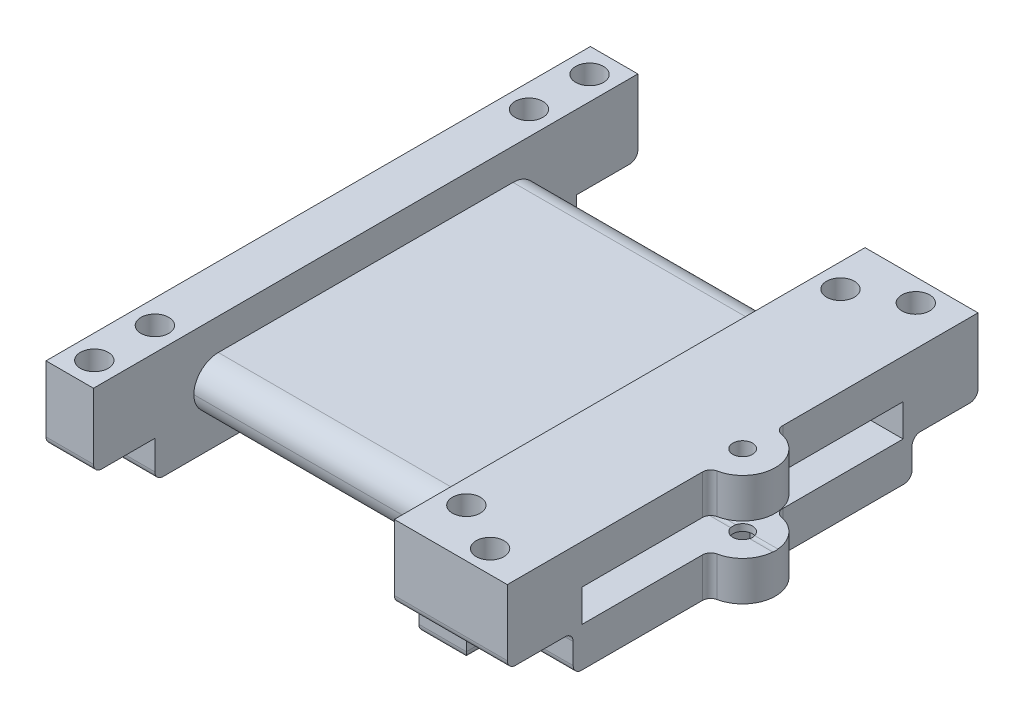
from build123d import *

# Parameters (mm, degrees)
SKETCH1_W              = 42
SKETCH1_H              = 5.9
SKETCH1_W_2            = 39.2
SKETCH1_H_2            = 3.95
BOSS_EXTRUDE1_DEPTH    = 32.25
FILLET2_R              = 3
SKETCH2_W              = 51.5
SKETCH2_H              = 13.6
SKETCH2_W_2            = 39.2
SKETCH2_H_2            = 3.95
BOSS_EXTRUDE2_DEPTH    = 5.8
SKETCH3_W              = 51.5
SKETCH3_H              = 13.6
SKETCH3_W_2            = 39.2
SKETCH3_H_2            = 3.95
BOSS_EXTRUDE3_DEPTH    = 5.8
SKETCH4_R              = 1.7
CUT_EXTRUDE1_DEPTH     = 62.792596644
SKETCH8_W              = 5.8
SKETCH8_H              = 7.5
BOSS_EXTRUDE4_DEPTH    = 13.6
M2_CLEARANCE_HOLE1_D   = 2.4
CUT_EXTRUDE4_DEPTH     = 4
SKETCH15_W             = 39.2
SKETCH15_H             = 3.95
CUT_EXTRUDE5_DEPTH     = 79.468767672
SKETCH17_R             = 2
CUT_EXTRUDE6_DEPTH     = 79.468767672
M3_CLEARANCE_HOLE1_D   = 3.4
CUT_EXTRUDE8_START     = -13.6
CUT_EXTRUDE8_OUTLINE_W = 5.8
CUT_EXTRUDE8_OUTLINE_H = 7.5
CUT_EXTRUDE8_OUTLINE_R = 1.7
CUT_EXTRUDE8_DEPTH     = 4.55
FILLET3_R              = 1


# Read off the part's stored shape, not the designer's step: Cut-Extrude8
with BuildPart() as part:
    # Sketch1 → Boss-Extrude1 (new body)
    with BuildSketch(Plane(origin=(0, 0, 0), x_dir=(0, 0, -1), z_dir=(1, 0, 0))):
        with Locations((21, 2.95)):
            Rectangle(SKETCH1_W, SKETCH1_H)
        with Locations((21, 2.95)):
            Rectangle(SKETCH1_W_2, SKETCH1_H_2, mode=Mode.SUBTRACT)
    extrude(amount=BOSS_EXTRUDE1_DEPTH)

    # Fillet2
    # the kernel refuses this fillet: 3 mm, written as the material it takes off along each edge
    with BuildSketch(Plane(origin=(-7.5, 0, -42), x_dir=(0, 0, 1), z_dir=(1, 0, 0)), Plane(origin=(-7.5, 5.9, 0), x_dir=(0, 0, -1), z_dir=(1, 0, 0)), Plane(origin=(-7.5, 5.9, -42), x_dir=(0, -1, 0), z_dir=(1, 0, 0))) as fillet2_piece_1:
        with BuildLine():
            CenterArc((FILLET2_R, -FILLET2_R), FILLET2_R, 90, 90)
            Line((0, -FILLET2_R), (0, 0))
            Line((0, 0), (FILLET2_R, 0))
        make_face()
    extrude(amount=47.25, mode=Mode.SUBTRACT)
    with BuildSketch(Plane(origin=(-7.5, 0, 0), x_dir=(0, 0, -1), z_dir=(1, 0, 0))) as fillet2_piece_2:
        with BuildLine():
            CenterArc((FILLET2_R, FILLET2_R), FILLET2_R, 180, 90)
            Line((0, FILLET2_R), (0, 0))
            Line((0, 0), (FILLET2_R, 0))
        make_face()
    extrude(amount=47.25, mode=Mode.SUBTRACT)

    # Sketch2 → Boss-Extrude2 (add)
    with BuildSketch(Plane(origin=(32.25, 0, 0), x_dir=(0, 0, -1), z_dir=(1, 0, 0))):
        with Locations((21, 2.95)):
            Rectangle(SKETCH2_W, SKETCH2_H)
        with Locations((21, 2.95)):
            Rectangle(SKETCH2_W_2, SKETCH2_H_2, mode=Mode.SUBTRACT)
    extrude(amount=BOSS_EXTRUDE2_DEPTH)

    # Sketch3 → Boss-Extrude3 (add)
    with BuildSketch(Plane.ZY):
        with Locations((-21, 2.95)):
            Rectangle(SKETCH3_W, SKETCH3_H)
        with Locations((-21, 2.95)):
            Rectangle(SKETCH3_W_2, SKETCH3_H_2, mode=Mode.SUBTRACT)
    extrude(amount=BOSS_EXTRUDE3_DEPTH)

    # Sketch4 → Cut-Extrude1 (cut, through all)
    with BuildSketch(Plane(origin=(0, 9.75, 0), x_dir=(1, 0, 0), z_dir=(0, 1, 0))):
        with Locations(Location((-2.9, 43.85, 0), (0, 0, 270))):
            Circle(SKETCH4_R)
        with Locations(Location((35.15, 43.85, 0), (0, 0, 270))):
            Circle(SKETCH4_R)
        with Locations(Location((-2.9, -1.85, 0), (0, 0, 270))):
            Circle(SKETCH4_R)
        with Locations(Location((35.15, -1.85, 0), (0, 0, 270))):
            Circle(SKETCH4_R)
    extrude(amount=-CUT_EXTRUDE1_DEPTH, mode=Mode.SUBTRACT)

    # Sketch8 → Boss-Extrude4 (add)
    with BuildSketch(Plane(origin=(0, 9.75, 0), x_dir=(1, 0, 0), z_dir=(0, 1, 0))):
        with Locations((-2.9, 50.5)):
            Rectangle(SKETCH8_W, SKETCH8_H)
        with Locations((-2.9, -8.5)):
            Rectangle(SKETCH8_W, SKETCH8_H)
        with BuildLine():
            Line((46.05, 25), (46.05, 49.75))
            Line((46.05, 49.75), (32.25, 49.75))
            Line((32.25, 49.75), (32.25, 46.75))
            Line((32.25, 46.75), (38.05, 46.75))
            Line((38.05, 46.75), (38.05, -4.75))
            Line((38.05, -4.75), (32.25, -4.75))
            Line((32.25, -4.75), (32.25, -7.75))
            Line((32.25, -7.75), (46.05, -7.75))
            Line((46.05, -7.75), (46.05, 17))
            ThreePointArc((46.05, 17), (50.05, 21), (46.05, 25))
        make_face()
    extrude(amount=-BOSS_EXTRUDE4_DEPTH)

    # M2 Clearance Hole1 (through all)
    with Locations(Plane(origin=(0, 9.75, 0), x_dir=(1, 0, 0), z_dir=(0, 1, 0))):
        with Locations((46.05, 21)):
            Hole(M2_CLEARANCE_HOLE1_D / 2)

    # Sketch14 → Cut-Extrude4 (cut)
    with BuildSketch(Plane.XZ.offset(3.85)):
        Polygon((43.625128869, -21), (44.837564435, -23.1), (47.262435565, -23.1), (48.474871131, -21), (47.262435565, -18.9), (44.837564435, -18.9), align=None)
    extrude(amount=-CUT_EXTRUDE4_DEPTH, mode=Mode.SUBTRACT)

    # Sketch15 → Cut-Extrude5 (cut, through all)
    with BuildSketch(Plane.ZY.offset(5.8)):
        with Locations((-21, 2.95)):
            Rectangle(SKETCH15_W, SKETCH15_H)
    extrude(amount=-CUT_EXTRUDE5_DEPTH, mode=Mode.SUBTRACT)

    # Sketch17 → Cut-Extrude6 (cut, through all)
    with BuildSketch(Plane.ZY.offset(5.8)):
        with Locations((-21, 2.95)):
            Circle(SKETCH17_R)
    extrude(amount=-CUT_EXTRUDE6_DEPTH, mode=Mode.SUBTRACT)

    # M3 Clearance Hole1 (through all)
    with Locations(Plane(origin=(-2.9, 9.75, -51.25), x_dir=(0, 0, 1), z_dir=(0, 1, 0))):
        with Locations((0, 0), (4.25, 44.1), (56.25, 44.1), (60.5, 0)):
            Hole(M3_CLEARANCE_HOLE1_D / 2)

    # Cut-Extrude8 outline → Cut-Extrude8 (cut)
    # profile 1 of 4: a face of its own
    with BuildSketch(Plane(origin=(0, 9.75, 0), x_dir=(1, 0, 0), z_dir=(0, 1, 0)).offset(CUT_EXTRUDE8_START)):
        with Locations((-2.9, 50.5)):
            Rectangle(CUT_EXTRUDE8_OUTLINE_W, CUT_EXTRUDE8_OUTLINE_H)
        with Locations((-2.9, 51.25)):
            Circle(CUT_EXTRUDE8_OUTLINE_R, mode=Mode.SUBTRACT)
    # profile 2 of 4: a face of its own
    with BuildSketch(Plane(origin=(0, 9.75, 0), x_dir=(1, 0, 0), z_dir=(0, 1, 0)).offset(CUT_EXTRUDE8_START)):
        with Locations((-2.9, -8.5)):
            Rectangle(CUT_EXTRUDE8_OUTLINE_W, CUT_EXTRUDE8_OUTLINE_H)
        with Locations((-2.9, -9.25)):
            Circle(CUT_EXTRUDE8_OUTLINE_R, mode=Mode.SUBTRACT)
    # profile 3 of 4: a face of its own
    with BuildSketch(Plane(origin=(0, 9.75, 0), x_dir=(1, 0, 0), z_dir=(0, 1, 0)).offset(CUT_EXTRUDE8_START)):
        Polygon((32.25, 49.75), (32.25, 46.75), (38.05, 46.75), (38.05, 41.7), (46.05, 41.7), (46.05, 49.75), align=None)
        with Locations((41.2, 47)):
            Circle(CUT_EXTRUDE8_OUTLINE_R, mode=Mode.SUBTRACT)
    # profile 4 of 4: a face of its own
    with BuildSketch(Plane(origin=(0, 9.75, 0), x_dir=(1, 0, 0), z_dir=(0, 1, 0)).offset(CUT_EXTRUDE8_START)):
        Polygon((38.05, -4.75), (32.25, -4.75), (32.25, -7.75), (46.05, -7.75), (46.05, 0.3), (38.05, 0.3), align=None)
        with Locations((41.2, -5)):
            Circle(CUT_EXTRUDE8_OUTLINE_R, mode=Mode.SUBTRACT)
    extrude(amount=CUT_EXTRUDE8_DEPTH, mode=Mode.SUBTRACT)

    # Fillet3
    fillet3_edges = [part.edges().sort_by_distance(p)[0] for p in [
        (46.05, -1.4375, -25),
        (46.05, -1.4375, -17),
        (46.05, 7.3375, -17),
        (46.05, 7.3375, -25),
        (39.15, 0.7, -49.75),
        (42.05, -3.85, -41.7),
        (38.05, -3.85, -44.225),
        (35.15, -3.85, -46.75),
        (38.05, 0.7, -44.225),
        (42.05, 0.7, -41.7),
        (38.05, -1.575, -41.7),
        (42.05, 0.7, -0.3),
        (35.15, -3.85, 4.75),
        (38.05, -3.85, 2.225),
        (39.15, 0.7, 7.75),
        (42.05, -3.85, -0.3),
        (38.05, 0.7, 2.225),
        (38.05, -1.575, -0.3),
        (-2.9, 0.7, 12.25),
        (-2.9, -3.85, 4.75),
        (-2.9, -3.85, -46.75),
        (-2.9, 0.7, -54.25),
    ]]
    fillet(fillet3_edges, radius=FILLET3_R)


solid = part.part
